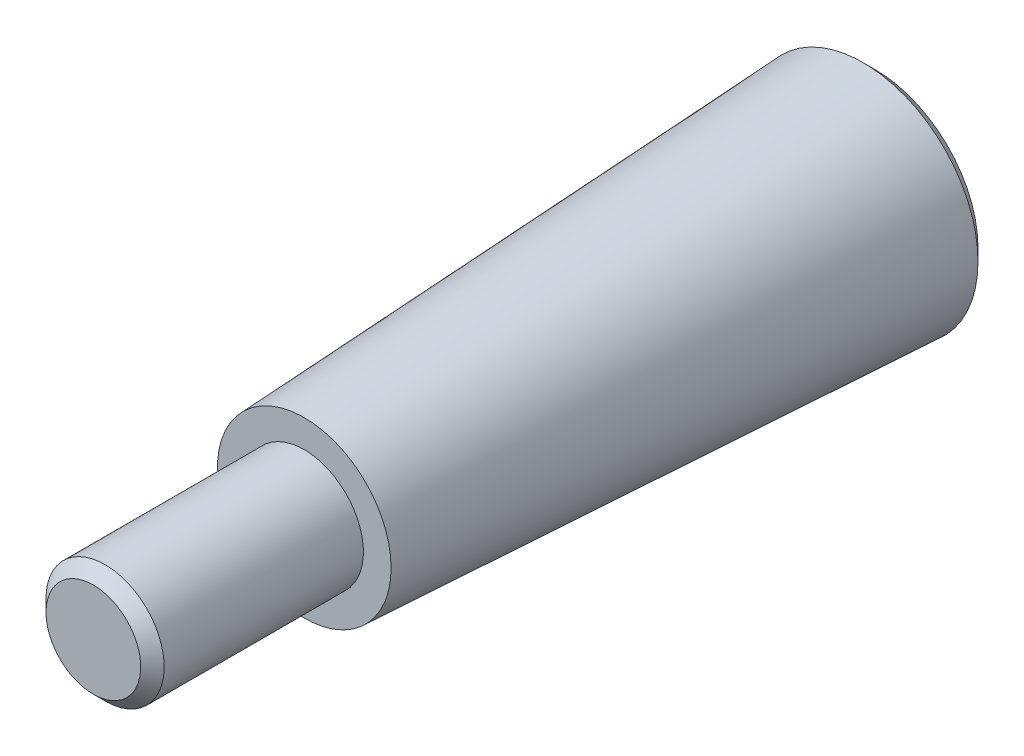
from build123d import *

# Parameters (mm, degrees)
SKETCH_1_R      = 5
EXTRUDE_1_DEPTH = 17
CHAMFER_1_SIZE  = 1
CHAMFER_1_SIZE2 = 0.953570685


# Read off the part's stored shape, not the designer's step: 3/8-16 机械螺纹 螺柱1
with BuildPart() as part:
    # 草图1 → 凸台-拉伸1 (new body)
    with BuildSketch(Plane.XY):
        Circle(SKETCH_1_R)
    extrude(amount=-EXTRUDE_1_DEPTH)

    # 3/8-16 机械螺纹 螺柱1 outline → 3/8-16 机械螺纹 螺柱1 (revolve, cut)
    with BuildSketch(Plane.XZ):
        Polygon((5, 0), (3.81635, 0), (4.7625, -0.94615), (4.7625, -17), (5, -17), align=None)
    revolve(axis=Axis((0, 0, 0), (0, 0, 1)), mode=Mode.SUBTRACT)

    # 草图4 → 旋转1 (revolve)
    with BuildSketch(Plane(origin=(0, 0, 0), x_dir=(0, 0, -1), z_dir=(1, 0, 0)), mode=Mode.PRIVATE) as revolve_1_sk:
        Polygon((17, 0), (37.344329095, 0), (63, 0), (63, 9.3), (17, 7), align=None)
    revolve(revolve_1_sk.sketch.rotate(Axis((0, 0, -37.344329095), (0, 0, -1)), 270), axis=Axis((0, 0, -37.344329095), (0, 0, -1)))

    # 倒角1
    chamfer_1_edges = [part.edges().sort_by_distance(p)[0] for p in [
        (9.3, 0, -63),
    ]]
    chamfer_1_side = [part.faces().sort_by_distance(p)[0] for p in [
        (0, 0, -63),
    ]]
    chamfer(chamfer_1_edges, length=CHAMFER_1_SIZE, length2=CHAMFER_1_SIZE2, reference=chamfer_1_side[0])


solid = part.part
